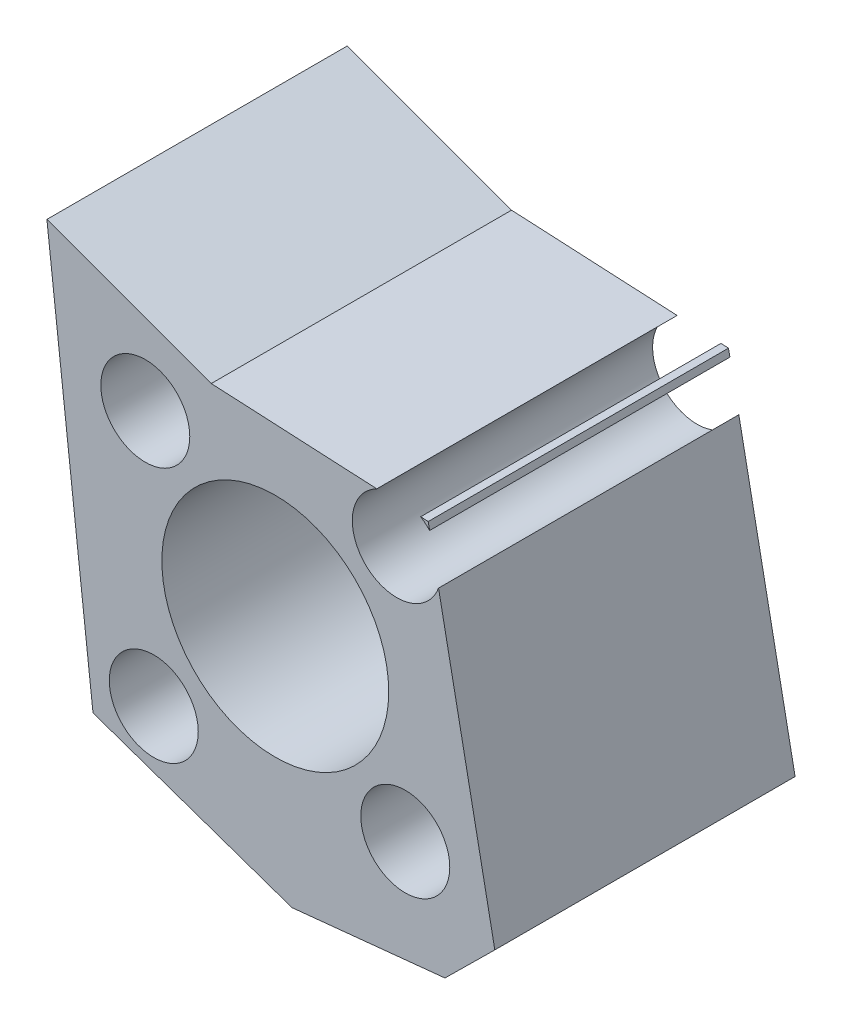
from build123d import *

# Parameters (mm, degrees)
BOSS_EXTRUDE1_DEPTH = 13.5
SKETCH5_R           = 5.1
CUT_EXTRUDE1_DEPTH  = 33.379022791
SKETCH6_R           = 2
CUT_EXTRUDE2_DEPTH  = 33.379022791


# Read off the part's stored shape, not the designer's step: Surface-Imported1
with BuildPart() as part:
    # Sketch4 → Boss-Extrude1 (new body)
    with BuildSketch(Plane.XY):
        Polygon((-10.267682095, -6.293488643), (-2.878710045, -8.990480099), (6.875002431, -9.485717684), (9.869890593, -24.668384875), (7.628097669, -26.882227025), (0.750257566, -27.581258516), (-8.194806094, -24.472611169), align=None)
    extrude(amount=BOSS_EXTRUDE1_DEPTH)

    # Sketch5 → Cut-Extrude1 (cut, through all)
    with BuildSketch(Plane.XY):
        with Locations((-3.0289e-05, -17.000002655)):
            Circle(SKETCH5_R)
    extrude(amount=CUT_EXTRUDE1_DEPTH, mode=Mode.SUBTRACT)

    # Sketch6 → Cut-Extrude2 (cut, through all)
    with BuildSketch(Plane.XY):
        with Locations((-5.84457319, -11.537281879)):
            Circle(SKETCH6_R)
        with Locations((5.462690487, -11.155459754)):
            Circle(SKETCH6_R)
        with Locations((5.844512612, -22.462723431)):
            Circle(SKETCH6_R)
        with Locations((-5.462751065, -22.844545557)):
            Circle(SKETCH6_R)
    extrude(amount=CUT_EXTRUDE2_DEPTH, mode=Mode.SUBTRACT)


with BuildPart() as cut_extrude2_piece_1:
    # of the separate pieces the step leaves, piece 1, a body of its own (cut_extrude2_pieces)
    add(part.part.solids().sort_by_distance((-10.267682095, -6.293488643, 0))[0])


with BuildPart() as cut_extrude2_piece_2:
    # of the separate pieces the step leaves, piece 2, a body of its own (cut_extrude2_pieces)
    add(part.part.solids().sort_by_distance((6.537108382, -9.468561362, 0))[0])


solid = Compound([cut_extrude2_piece_1.part, cut_extrude2_piece_2.part])
